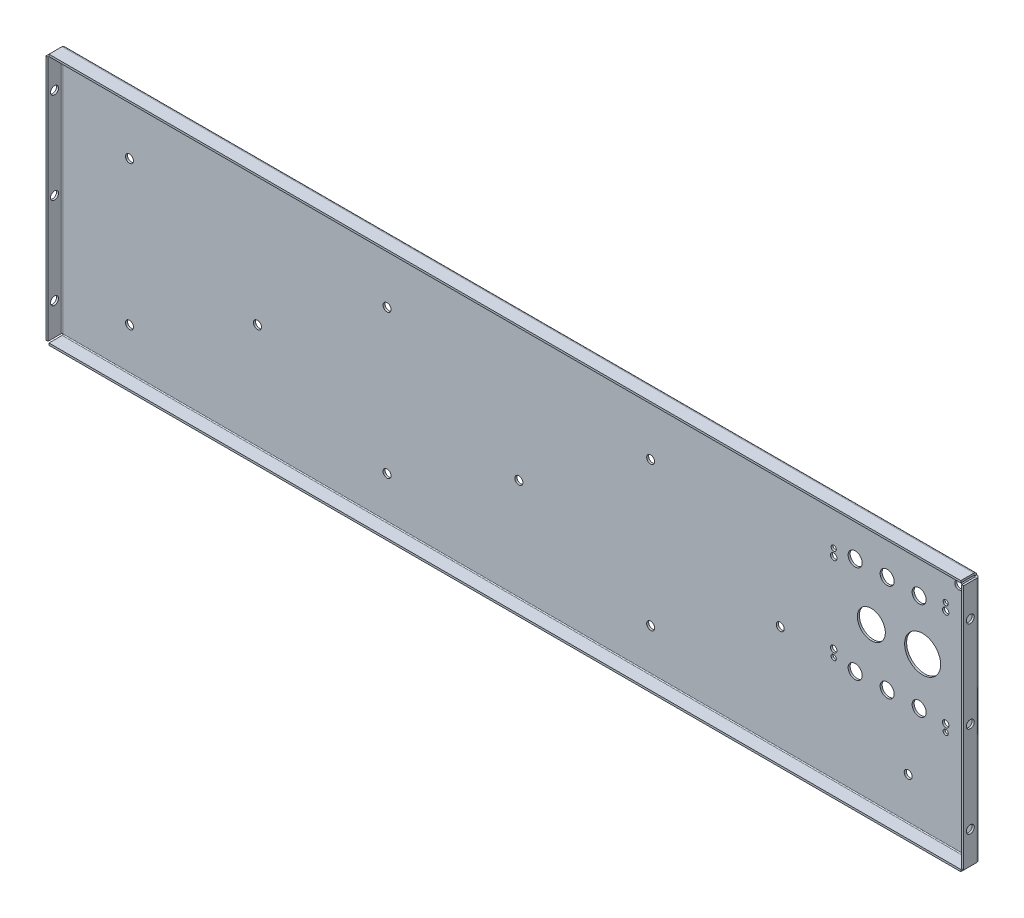
from build123d import *

# Parameters (mm, degrees)
SKETCH1_W                    = 723.9
SKETCH1_H                    = 200.152
BASE_FLANGE1_DEPTH           = 1.6002
EDGE_FLANGE1_STRIP_W         = 7.874
EDGE_FLANGE1_STRIP_H         = 1.6002
EDGE_FLANGE1_STRIP_CUT_DEPTH = 723.9
EDGE_FLANGE1_DEPTH           = 723.9
EDGE_FLANGE2_STRIP_W         = 7.874
EDGE_FLANGE2_STRIP_H         = 1.6002
EDGE_FLANGE2_STRIP_CUT_DEPTH = 723.9
EDGE_FLANGE2_DEPTH           = 723.9
SKETCH12_R                   = 3.175
SKETCH12_R_2                 = 14.2875
CUT_EXTRUDE1_DEPTH           = 376.744991019
SKETCH13_R                   = 3.175
CUT_EXTRUDE2_DEPTH           = 395.072064437
EDGE_FLANGE3_DEPTH           = 195.4784
EDGE_FLANGE3_BEND_DEPTH      = 195.4784
SKETCH20_R                   = 3.175
CUT_EXTRUDE3_DEPTH           = 736.498403773
SKETCH22_R                   = 5.55625
SKETCH22_R_2                 = 2.5527
SKETCH22_R_3                 = 2.0447
SKETCH22_R_4                 = 11.10615
CUT_EXTRUDE4_DEPTH           = 378.946139007
SKETCH23_R                   = 3.175
CUT_EXTRUDE5_DEPTH           = 378.996519072


# Sheet-metal steps are written as plain solids
with BuildPart() as part:
    # Base-Flange1: sheet metal written as solids
    # Sketch1 → Base-Flange1 (new body)
    with BuildSketch(Plane.XY):
        Rectangle(SKETCH1_W, SKETCH1_H)
    extrude(amount=-BASE_FLANGE1_DEPTH)

    # Edge-Flange1: sheet metal written as solids
    # Edge-Flange1 strip (on a plane across the edge) → Edge-Flange1 strip cut (cut)
    with BuildSketch(Plane(origin=(361.95, 100.076, 0), x_dir=(0, -1, 0), z_dir=(-1, 0, 0))):
        with Locations((-1.6002, -0.8001)):
            Rectangle(EDGE_FLANGE1_STRIP_W, EDGE_FLANGE1_STRIP_H)
    extrude(amount=EDGE_FLANGE1_STRIP_CUT_DEPTH, mode=Mode.SUBTRACT)

    # Edge-Flange1 section (on a plane across the edge) → Edge-Flange1 (add)
    with BuildSketch(Plane(origin=(361.95, 100.076, 0), x_dir=(0, -1, 0), z_dir=(-1, 0, 0))):
        with BuildLine():
            Line((0, 0.7366), (0, 11.0998))
            Line((0, 11.0998), (1.6002, 11.0998))
            Line((1.6002, 11.0998), (1.6002, 0.7366))
            ThreePointArc((1.6002, 0.7366), (1.815945145, 0.215745145), (2.3368, 0))
            Line((2.3368, 0), (2.3368, -1.6002))
            ThreePointArc((2.3368, -1.6002), (0.684432874, -0.915767126), (0, 0.7366))
        make_face()
    extrude(amount=EDGE_FLANGE1_DEPTH)

    # Edge-Flange2: sheet metal written as solids
    # Edge-Flange2 strip (on a plane across the edge) → Edge-Flange2 strip cut (cut)
    with BuildSketch(Plane(origin=(-361.95, -100.076, 0), x_dir=(0, 1, 0), z_dir=(1, 0, 0))):
        with Locations((-1.6002, -0.8001)):
            Rectangle(EDGE_FLANGE2_STRIP_W, EDGE_FLANGE2_STRIP_H)
    extrude(amount=EDGE_FLANGE2_STRIP_CUT_DEPTH, mode=Mode.SUBTRACT)

    # Edge-Flange2 section (on a plane across the edge) → Edge-Flange2 (add)
    with BuildSketch(Plane(origin=(-361.95, -100.076, 0), x_dir=(0, 1, 0), z_dir=(1, 0, 0))):
        with BuildLine():
            Line((0, 0.7366), (0, 11.0998))
            Line((0, 11.0998), (1.6002, 11.0998))
            Line((1.6002, 11.0998), (1.6002, 0.7366))
            ThreePointArc((1.6002, 0.7366), (1.815945145, 0.215745145), (2.3368, 0))
            Line((2.3368, 0), (2.3368, -1.6002))
            ThreePointArc((2.3368, -1.6002), (0.684432874, -0.915767126), (0, 0.7366))
        make_face()
    extrude(amount=EDGE_FLANGE2_DEPTH)

    # Sketch12 → Cut-Extrude1 (cut, through all)
    with BuildSketch(Plane(origin=(0, 0, -1.6002), x_dir=(-1, 0, 0), z_dir=(0, 0, -1))):
        with Locations((-207.518, -14.351)):
            Circle(SKETCH12_R)
        with Locations((0, -17.526)):
            Circle(SKETCH12_R)
        with Locations((207.518, -14.351)):
            Circle(SKETCH12_R)
        with Locations((-320.548, 23.268449438)):
            Circle(SKETCH12_R_2)
    extrude(amount=-CUT_EXTRUDE1_DEPTH, mode=Mode.SUBTRACT)

    # Sketch13 → Cut-Extrude2 (cut, through all)
    with BuildSketch(Plane(origin=(0, 0, -108.356399896), x_dir=(-1, 0, 0), z_dir=(0, 0, -1))):
        with Locations(Location((-309.118, -65.151, 0), (0, 0, 90))):
            Circle(SKETCH13_R)
        with Locations(Location((-104.638118017, -65.151, 0), (0, 0, 90))):
            Circle(SKETCH13_R)
        with Locations(Location((-104.638118017, 49.149, 0), (0, 0, 90))):
            Circle(SKETCH13_R)
        with Locations(Location((104.638118017, 49.149, 0), (0, 0, 90))):
            Circle(SKETCH13_R)
        with Locations(Location((104.638118017, -65.151, 0), (0, 0, 90))):
            Circle(SKETCH13_R)
        with Locations(Location((309.118, -65.151, 0), (0, 0, 90))):
            Circle(SKETCH13_R)
        with Locations(Location((309.118, 49.149, 0), (0, 0, 90))):
            Circle(SKETCH13_R)
    extrude(amount=-CUT_EXTRUDE2_DEPTH, mode=Mode.SUBTRACT)

    # Edge-Flange3: sheet metal written as solids
    # Edge-Flange3 section (on a plane across the edge) → Edge-Flange3 (add)
    with BuildSketch(Plane(origin=(-362.6866, 97.7392, 0), x_dir=(1, 0, 0), z_dir=(0, -1, 0))):
        with BuildLine():
            Line((-1.6002, 0.7366), (-1.6002, 11.0998))
            Line((-1.6002, 11.0998), (0, 11.0998))
            Line((0, 11.0998), (0, 0.7366))
            ThreePointArc((0, 0.7366), (0.215745145, 0.215745145), (0.7366, 0))
            Line((0.7366, 0), (0.7366, -1.6002))
            ThreePointArc((0.7366, -1.6002), (-0.915767126, -0.915767126), (-1.6002, 0.7366))
        make_face()
    extrude(amount=EDGE_FLANGE3_DEPTH)

    # Edge-Flange3 section 2 (on a plane across the edge) → Edge-Flange3 bend (add)
    with BuildSketch(Plane(origin=(362.6866, -97.7392, 0), x_dir=(-1, 0, 0), z_dir=(0, 1, 0))):
        with BuildLine():
            Line((-1.6002, 0.7366), (-1.6002, 11.0998))
            Line((-1.6002, 11.0998), (0, 11.0998))
            Line((0, 11.0998), (0, 0.7366))
            ThreePointArc((0, 0.7366), (0.215745145, 0.215745145), (0.7366, 0))
            Line((0.7366, 0), (0.7366, -1.6002))
            ThreePointArc((0.7366, -1.6002), (-0.915767126, -0.915767126), (-1.6002, 0.7366))
        make_face()
    extrude(amount=EDGE_FLANGE3_BEND_DEPTH)

    # Sketch20 → Cut-Extrude3 (cut, through all)
    with BuildSketch(Plane.ZY.offset(364.2868)):
        with Locations((5.9182, 72.3392)):
            Circle(SKETCH20_R)
        with Locations((5.9182, 0)):
            Circle(SKETCH20_R)
        with Locations((5.9182, -72.3392)):
            Circle(SKETCH20_R)
    extrude(amount=-CUT_EXTRUDE3_DEPTH, mode=Mode.SUBTRACT)

    # Sketch22 → Cut-Extrude4 (cut, through all)
    with BuildSketch(Plane.XY):
        with Locations((266.978063087, -15.466550562)):
            Circle(SKETCH22_R)
        with Locations((249.960063087, -8.481550562)):
            Circle(SKETCH22_R_2)
        with Locations((249.960063087, -14.323550562)):
            Circle(SKETCH22_R_3)
        with Locations((249.960063087, 55.018449438)):
            Circle(SKETCH22_R_2)
        with Locations((249.960063087, 60.860449438)):
            Circle(SKETCH22_R_3)
        with Locations((266.978063087, 62.003449438)):
            Circle(SKETCH22_R)
        with Locations((292.378063087, 62.003449438)):
            Circle(SKETCH22_R)
        with Locations((317.778063087, 62.003449438)):
            Circle(SKETCH22_R)
        with Locations((338.860063087, 62.003449438)):
            Circle(SKETCH22_R_2)
        with Locations((338.860063087, 67.845449438)):
            Circle(SKETCH22_R_3)
        with Locations((338.860063087, -15.466550562)):
            Circle(SKETCH22_R_2)
        with Locations((338.860063087, -21.308550562)):
            Circle(SKETCH22_R_3)
        with Locations((279.8318, 23.268449438)):
            Circle(SKETCH22_R_4)
        with Locations((292.378063087, -15.466550562)):
            Circle(SKETCH22_R)
        with Locations((317.778063087, -15.466550562)):
            Circle(SKETCH22_R)
    extrude(amount=-CUT_EXTRUDE4_DEPTH, mode=Mode.SUBTRACT)

    # Sketch23 → Cut-Extrude5 (cut, through all)
    with BuildSketch(Plane(origin=(0, 0, -1.6002), x_dir=(-1, 0, 0), z_dir=(0, 0, -1))):
        with Locations((-349.25, 85.0392)):
            Circle(SKETCH23_R)
    extrude(amount=-CUT_EXTRUDE5_DEPTH, mode=Mode.SUBTRACT)


solid = part.part
